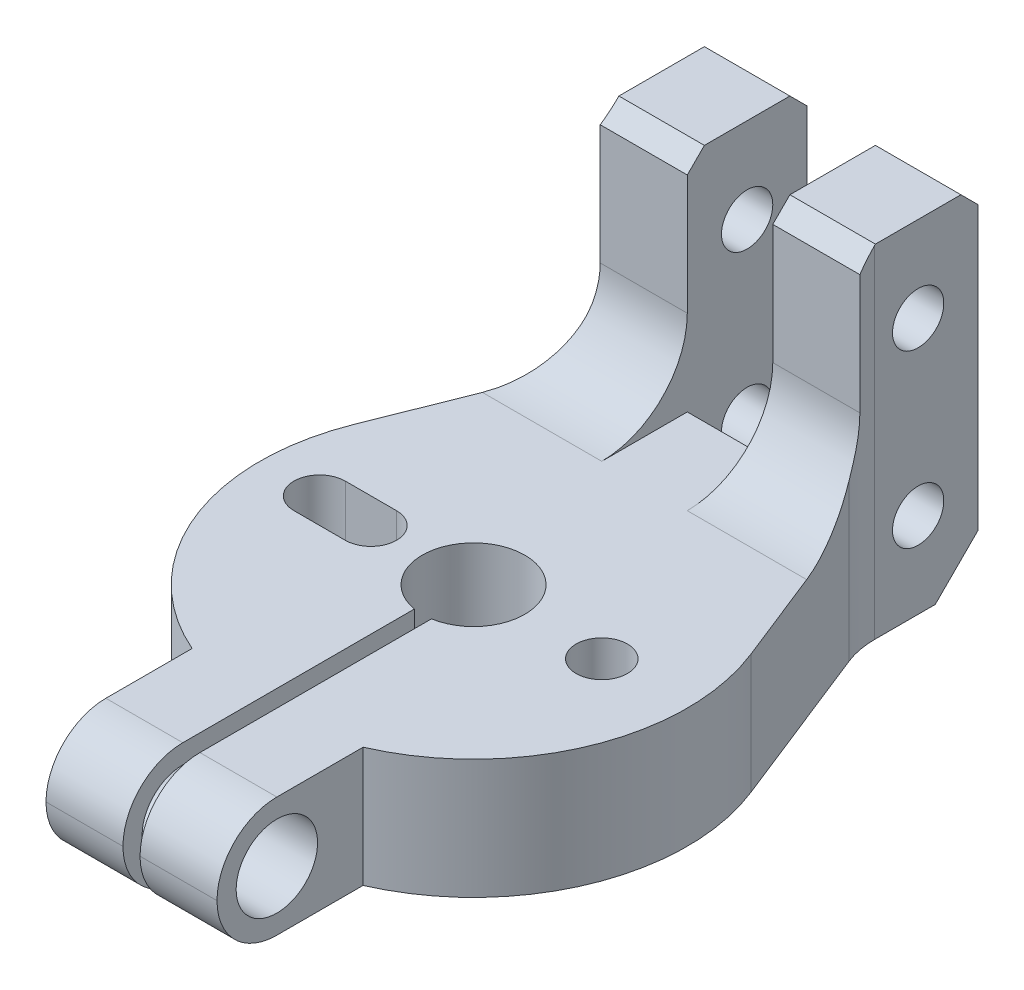
from build123d import *

# Parameters (mm, degrees)
SKETCH1_W           = 5
SKETCH1_H           = 7
BOSS_EXTRUDE1_DEPTH = 7
SKETCH3_R           = 2.38125
CUT_EXTRUDE2_DEPTH  = 29.969811874
FILLET2_R           = 3.5
SKETCH5_W           = 1
SKETCH5_H           = 8.5
CUT_EXTRUDE4_DEPTH  = 27.253571186
SKETCH6_R           = 1.5
CUT_EXTRUDE5_DEPTH  = 27.253571186
SKETCH8_W           = 5
SKETCH8_H           = 7
BOSS_EXTRUDE2_DEPTH = 13
FILLET3_DEPTH       = 20
FILLET3_2_DEPTH     = 8.22694
FILLET3_START       = -9.48212727
FILLET3_3_DEPTH     = 6.98212727
FILLET3_START_2     = 2.5
FILLET3_4_DEPTH     = 6.98212727
FILLET3_START_3     = 7
FILLET3_5_DEPTH     = 13.0000001
CHAMFER1_SIZE       = 2.5
CHAMFER2_SIZE       = 1
SKETCH9_R           = 1.5
CUT_EXTRUDE7_DEPTH  = 36.832945734


with BuildPart() as part:
    # Sketch1 → Boss-Extrude1 (new body)
    with BuildSketch(Plane(origin=(0, 0, 0), x_dir=(1, 0, 0), z_dir=(0, 1, 0))):
        with BuildLine():
            Line((-5, -5), (-5, -11.456439237))
            ThreePointArc((-5, -11.456439237), (0, -12.5), (5, -11.456439237))
            Line((5, -11.456439237), (5, -5))
            Line((5, -5), (-5, -5))
        make_face()
        with BuildLine():
            ThreePointArc((-11.620226592, 4.606553371), (-11.556942324, -4.763096065), (-5, -11.456439237))
            Line((-5, -11.456439237), (-5, -5))
            Line((-5, -5), (5, -5))
            Line((5, -5), (5, -11.456439237))
            ThreePointArc((5, -11.456439237), (10.458250332, -6.846531969), (12.5, 0))
            ThreePointArc((12.5, 0), (12.27808683, 2.344905926), (11.620226592, 4.606553371))
            ThreePointArc((11.620226592, 4.606553371), (0, 12.5), (-11.620226592, 4.606553371))
        make_face()
        with BuildLine():
            Line((-5, -11.456439237), (-5, -20))
            Line((-5, -20), (5, -20))
            Line((5, -20), (5, -11.456439237))
            ThreePointArc((5, -11.456439237), (0, -12.5), (-5, -11.456439237))
        make_face()
        with BuildLine():
            Line((-7.5, 15), (-11.620226592, 4.606553371))
            ThreePointArc((-11.620226592, 4.606553371), (0, 12.5), (11.620226592, 4.606553371))
            Line((11.620226592, 4.606553371), (7.5, 15))
            Line((7.5, 15), (2.5, 15))
            Line((2.5, 15), (-2.5, 15))
            Line((-2.5, 15), (-7.5, 15))
        make_face()
        with Locations((-5, 18.5)):
            Rectangle(SKETCH1_W, SKETCH1_H)
        with Locations((5, 18.5)):
            Rectangle(SKETCH1_W, SKETCH1_H)
    extrude(amount=BOSS_EXTRUDE1_DEPTH)

    # Sketch3 → Cut-Extrude2 (cut, through all)
    with BuildSketch(Plane.ZY.offset(5)):
        with Locations((16.5, 3.5)):
            Circle(SKETCH3_R)
    extrude(amount=-CUT_EXTRUDE2_DEPTH, mode=Mode.SUBTRACT)

    # Fillet2
    fillet2_edges = [part.edges().sort_by_distance(p)[0] for p in [
        (0, 0, 20),
        (0, 7, 20),
    ]]
    fillet(fillet2_edges, radius=FILLET2_R - 0.0001)  # a hair under: the kernel refuses the full size

    # Sketch5 → Cut-Extrude4 (cut, through all)
    with BuildSketch(Plane(origin=(0, 7, 0), x_dir=(1, 0, 0), z_dir=(0, 1, 0))):
        with BuildLine():
            ThreePointArc((3, 0), (-1.936491673, 2.291287847), (-0.5, -2.958039892))
            Line((-0.5, -2.958039892), (-0.5, 0))
            Line((-0.5, 0), (0.5, 0))
            Line((0.5, 0), (0.5, -2.958039892))
            ThreePointArc((0.5, -2.958039892), (2.291287847, -1.936491673), (3, 0))
        make_face()
        with BuildLine():
            Line((-0.5, 0), (-0.5, -2.958039892))
            ThreePointArc((-0.5, -2.958039892), (0, -3), (0.5, -2.958039892))
            Line((0.5, -2.958039892), (0.5, 0))
            Line((0.5, 0), (-0.5, 0))
        make_face()
        with BuildLine():
            Line((-0.5, -2.958039892), (-0.5, -16.5))
            Line((-0.5, -16.5), (0.5, -16.5))
            Line((0.5, -16.5), (0.5, -2.958039892))
            ThreePointArc((0.5, -2.958039892), (0, -3), (-0.5, -2.958039892))
        make_face()
        with Locations((0, -20.75)):
            Rectangle(SKETCH5_W, SKETCH5_H)
    extrude(amount=-CUT_EXTRUDE4_DEPTH, mode=Mode.SUBTRACT)

    # Sketch6 → Cut-Extrude5 (cut, through all)
    with BuildSketch(Plane(origin=(0, 7, 0), x_dir=(1, 0, 0), z_dir=(0, 1, 0))):
        with Locations(Location((7.5, 0, 0), (0, 0, 270))):
            Circle(SKETCH6_R)
        with BuildLine():
            Line((-9, 1.5), (-6, 1.5))
            ThreePointArc((-6, 1.5), (-4.5, 0), (-6, -1.5))
            Line((-6, -1.5), (-9, -1.5))
            ThreePointArc((-9, -1.5), (-10.5, 0), (-9, 1.5))
        make_face()
    extrude(amount=-CUT_EXTRUDE5_DEPTH, mode=Mode.SUBTRACT)

    # Sketch8 → Boss-Extrude2 (add)
    with BuildSketch(Plane(origin=(0, 7, 0), x_dir=(1, 0, 0), z_dir=(0, 1, 0))):
        with Locations((-5, 18.5)):
            Rectangle(SKETCH8_W, SKETCH8_H)
        with Locations((5, 18.5)):
            Rectangle(SKETCH8_W, SKETCH8_H)
    extrude(amount=BOSS_EXTRUDE2_DEPTH)

    # Fillet3: read off the stored shape, not the designer's step
    # Fillet3 outline → Fillet3 (add)
    with BuildSketch(Plane(origin=(0, 0, 0), x_dir=(1, 0, 0), z_dir=(0, 1, 0))):
        with BuildLine():
            Line((7.5, 15), (7.592033284, 15))
            ThreePointArc((7.592033284, 15), (7.523061504, 15.475245132), (7.5, 15.954915028))
            Line((7.5, 15.954915028), (7.5, 15))
        make_face()
        with BuildLine():
            Line((-7.5, 15), (-7.5, 15.954915028))
            ThreePointArc((-7.5, 15.954915028), (-7.523061504, 15.475245132), (-7.592033284, 15))
            Line((-7.592033284, 15), (-7.5, 15))
        make_face()
    extrude(amount=FILLET3_DEPTH)

    # Fillet3 2 outline → Fillet3 2 (add)
    with BuildSketch(Plane(origin=(0, 0, 0), x_dir=(1, 0, 0), z_dir=(0, 1, 0))):
        with BuildLine():
            Line((7.5, 15), (7.851909363, 14.11229368))
            ThreePointArc((7.851909363, 14.11229368), (7.701399823, 14.550124532), (7.592033284, 15))
            Line((7.592033284, 15), (7.5, 15))
        make_face()
        with BuildLine():
            Line((-7.5, 15), (-7.592033284, 15))
            ThreePointArc((-7.592033284, 15), (-7.701399823, 14.550124532), (-7.851909363, 14.11229368))
            Line((-7.851909363, 14.11229368), (-7.5, 15))
        make_face()
    extrude(amount=FILLET3_2_DEPTH)

    # Fillet3 3 outline → Fillet3 3 (add)
    with BuildSketch(Plane.YZ.offset(FILLET3_START)):
        with BuildLine():
            ThreePointArc((12, -15), (8.464466094, -13.535533906), (7, -10))
            Line((7, -10), (7, -15))
            Line((7, -15), (8.22694, -15))
            Line((8.22694, -15), (12, -15))
        make_face()
    extrude(amount=FILLET3_3_DEPTH)

    # Fillet3 4 outline → Fillet3 4 (add)
    with BuildSketch(Plane.YZ.offset(FILLET3_START_2)):
        with BuildLine():
            ThreePointArc((12, -15), (8.464466094, -13.535533906), (7, -10))
            Line((7, -10), (7, -15))
            Line((7, -15), (8.22694, -15))
            Line((8.22694, -15), (12, -15))
        make_face()
    extrude(amount=FILLET3_4_DEPTH)

    # Fillet3 5 outline → Fillet3 5 (cut)
    with BuildSketch(Plane(origin=(0, 0, 0), x_dir=(1, 0, 0), z_dir=(0, 1, 0)).offset(FILLET3_START_3)):
        with BuildLine():
            ThreePointArc((7.592033284, 15), (7.701399823, 14.550124532), (7.851909363, 14.11229368))
            Line((7.851909363, 14.11229368), (9.482127184, 9.999999966))
            Line((9.482127184, 9.999999966), (9.48212727, 15))
            Line((9.48212727, 15), (7.592033284, 15))
        make_face()
        with BuildLine():
            ThreePointArc((-7.851909363, 14.11229368), (-7.701399823, 14.550124532), (-7.592033284, 15))
            Line((-7.592033284, 15), (-9.48212727, 15))
            Line((-9.48212727, 15), (-9.48212727, 10))
            Line((-9.48212727, 10), (-7.851909363, 14.11229368))
        make_face()
    extrude(amount=FILLET3_5_DEPTH, mode=Mode.SUBTRACT)

    # Chamfer1
    chamfer1_edges = [part.edges().sort_by_distance(p)[0] for p in [
        (-5, 0, -22),
        (5, 0, -22),
    ]]
    chamfer(chamfer1_edges, length=CHAMFER1_SIZE)

    # Chamfer2
    chamfer2_edges = [part.edges().sort_by_distance(p)[0] for p in [
        (-5.046016642, 20, -15),
        (5.046016642, 20, -15),
        (5, 20, -22),
        (-5, 20, -22),
    ]]
    chamfer(chamfer2_edges, length=CHAMFER2_SIZE)

    # Sketch9 → Cut-Extrude7 (cut, through all)
    with BuildSketch(Plane.ZY.offset(7.5)):
        with Locations((-18.5, 15)):
            Circle(SKETCH9_R)
        with Locations((-18.5, 5)):
            Circle(SKETCH9_R)
    extrude(amount=-CUT_EXTRUDE7_DEPTH, mode=Mode.SUBTRACT)


solid = part.part
